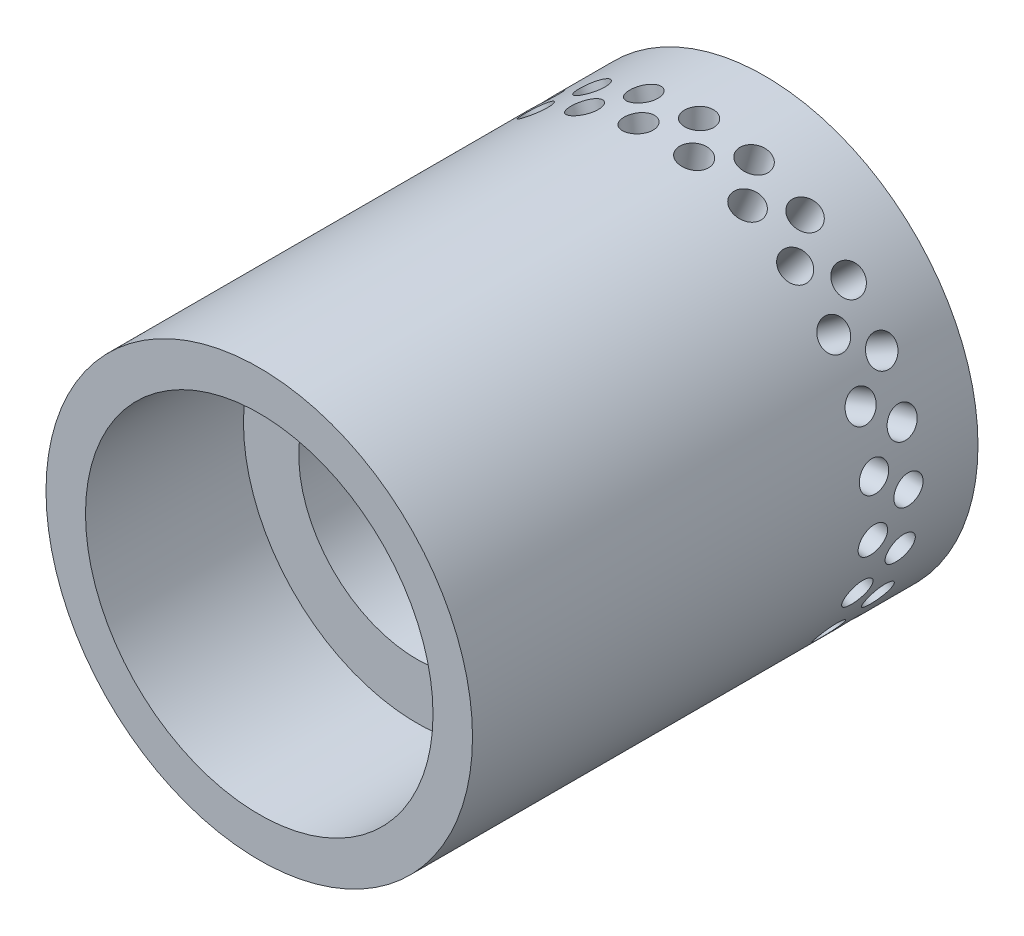
from build123d import *

# Parameters (mm, degrees)
SKETCH2_R                    = 13.5
BOSS_EXTRUDE1_DEPTH          = 32
SKETCH4_R                    = 11
CUT_EXTRUDE1_DEPTH           = 10
SKETCH5_R                    = 7.5
CUT_EXTRUDE2_DEPTH           = 30
F_1_85_1_85_DIAMETER_HOLE1_D = 1.85
CIRPATTERN1_COUNT            = 24
F_1_85_1_85_DIAMETER_HOLE2_D = 1.85
CIRPATTERN2_COUNT            = 24


with BuildPart() as part:
    # Sketch2 → Boss-Extrude1 (new body)
    with BuildSketch(Plane.XY):
        Circle(SKETCH2_R)
    extrude(amount=-BOSS_EXTRUDE1_DEPTH)

    # Sketch4 → Cut-Extrude1 (cut)
    with BuildSketch(Plane.XY):
        Circle(SKETCH4_R)
    extrude(amount=-CUT_EXTRUDE1_DEPTH, mode=Mode.SUBTRACT)

    # Sketch5 → Cut-Extrude2 (cut)
    with BuildSketch(Plane.XY):
        Circle(SKETCH5_R)
    extrude(amount=-CUT_EXTRUDE2_DEPTH, mode=Mode.SUBTRACT)

    # Ø1.85 (1.85) Diameter Hole1 (through all)
    with Locations(Plane(origin=(12.974927024, -3.728440521, -27.6), x_dir=(0.276180779305, 0.961105705499, 0), z_dir=(0.961105705499, -0.276180779305, 0))):
        with Locations((0, 0)):
            f_1_85_1_85_diameter_hole1 = Hole(F_1_85_1_85_DIAMETER_HOLE1_D / 2)

    # CirPattern1: Ø1.85 (1.85) Diameter Hole1 ×24 about axis
    cirpattern1_axis = Axis((0, 0, -32), (0, 0, 1))
    for i in range(1, CIRPATTERN1_COUNT):
        add(f_1_85_1_85_diameter_hole1.rotate(cirpattern1_axis, i * 360 / CIRPATTERN1_COUNT), mode=Mode.SUBTRACT)

    # Ø1.85 (1.85) Diameter Hole2 (through all)
    with Locations(Plane(origin=(12.574282839, 4.91298393, -25.5), x_dir=(-0.363924735528, 0.931428358421, 0), z_dir=(0.931428358421, 0.363924735528, 0))):
        with Locations((0, 0)):
            f_1_85_1_85_diameter_hole2 = Hole(F_1_85_1_85_DIAMETER_HOLE2_D / 2)

    # CirPattern2: Ø1.85 (1.85) Diameter Hole2 ×24 about axis
    cirpattern2_axis = Axis((0, 0, -32), (0, 0, 1))
    for i in range(1, CIRPATTERN2_COUNT):
        add(f_1_85_1_85_diameter_hole2.rotate(cirpattern2_axis, i * 360 / CIRPATTERN2_COUNT), mode=Mode.SUBTRACT)


solid = part.part
